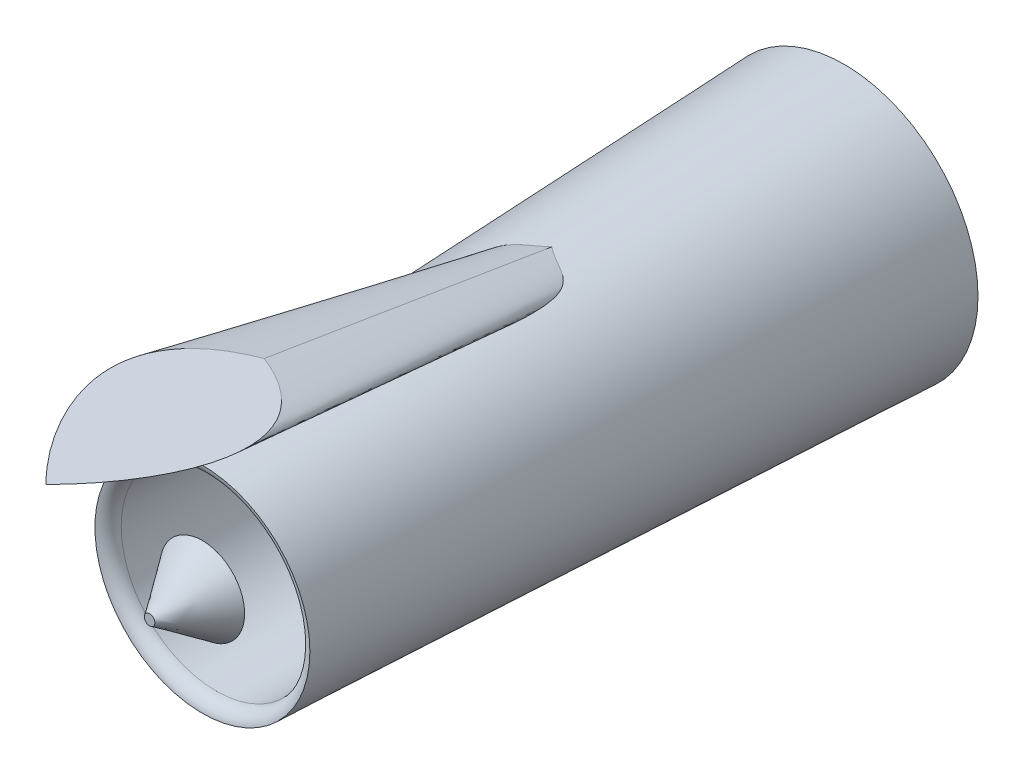
from build123d import *

# Parameters (mm, degrees)
SKETCH13_R              = 1159.51
SKETCH14_R              = 930.91
CUT_EXTRUDE1_DEPTH      = 10182.564733185
CUT_EXTRUDE1_DEPTH_BACK = 10182.564733185
SKETCH16_R              = 824.23
FILLET1_R               = 304.8
FILLET2_R               = 121.92


with BuildPart() as part:
    # Sketch13 → Loft2 section 0
    with BuildSketch(Plane.XY.offset(-1616.439178421)):
        with Locations((-7292.34, 0)):
            Circle(SKETCH13_R)
    # Sketch14 → Loft2 section 1
    with BuildSketch(Plane.XY.offset(3941.080821579)):
        with Locations((-7292.34, 0)):
            Circle(SKETCH14_R)
    loft()

    # Sketch16 → Cut-Extrude1 (cut, two sides: drawn at the far end of the back side and taken through both)
    with BuildSketch(Plane(origin=(0, 0, -1616.439178421), x_dir=(-1, 0, 0), z_dir=(0, 0, -1)).offset(-CUT_EXTRUDE1_DEPTH_BACK)):
        with Locations(Location((7292.34, 0, 0), (0, 0, 180))):
            Circle(SKETCH16_R)
    extrude(amount=CUT_EXTRUDE1_DEPTH + CUT_EXTRUDE1_DEPTH_BACK, mode=Mode.SUBTRACT)

    # Fillet1
    fillet1_edges = [part.edges().sort_by_distance(p)[0] for p in [
        (-8116.57, 0, -1616.439178421),
    ]]
    fillet(fillet1_edges, radius=FILLET1_R)

    # Fillet2
    # the kernel refuses this fillet: 121.92 mm, written as the material it takes off along each edge
    with BuildSketch(Plane(origin=(-7292.34, 0, 3941.080821579), x_dir=(1, 0, 0), z_dir=(0, 1, 0))) as fillet2_piece_1:
        with BuildLine():
            CenterArc((946.15, 120.963749942), FILLET2_R, 180, 82.819244219)
            Line((930.91, 0), (930.6052, -2.419274999))
            ThreePointArc((930.6052, -2.419274999), (877.57, -2.4384), (824.23, -2.4384))
            Line((824.23, -2.4384), (821.7916, 0))
            Line((821.7916, 0), (821.7916, 120.963749942))
            Line((821.7916, 120.963749942), (824.23, 120.963749942))
        make_face()
    revolve(axis=Axis((-7292.34, 0, 3941.080821579), (0, 0, -1)), mode=Mode.SUBTRACT)

    # Sketch20 → Loft4 section 0
    with BuildSketch(Plane(origin=(0, 1463.346394626, 0), x_dir=(1, 0, 0), z_dir=(0, 1, 0))):
        with BuildLine():
            add(Edge.make_bspline(
                [(-7292.34, -3406.150417238), (-6242.02499115, -3812.9932806), (-6806.427729263, -4813.335190791), (-7292.34, -5295.528257059)],
                knots=[0, 0, 0, 0, 1, 1, 1, 1], degree=3))
            add(Edge.make_bspline(
                [(-7292.34, -3406.150417238), (-8342.65500885, -3812.9932806), (-7778.252270737, -4813.335190791), (-7292.34, -5295.528257059)],
                knots=[0, 0, 0, 0, 1, 1, 1, 1], degree=3))
        make_face()
    # Sketch17 → Loft4 section 1
    with BuildSketch(Plane(origin=(0, 929.946394626, 0), x_dir=(1, 0, 0), z_dir=(0, 1, 0))):
        with BuildLine():
            add(Edge.make_bspline(
                [(-7292.34, -149.368821579), (-6646.095228766, -977.153508768), (-7181.494395174, -1981.271516216), (-7292.34, -2877.715495293)],
                knots=[0, 0, 0, 0, 1, 1, 1, 1], degree=3))
            add(Edge.make_bspline(
                [(-7292.34, -149.368821579), (-7938.584771234, -977.153508768), (-7403.185604826, -1981.271516216), (-7292.34, -2877.715495293)],
                knots=[0, 0, 0, 0, 1, 1, 1, 1], degree=3))
        make_face()
    loft()


with BuildPart() as body_2:
    # Loft3: read off the stored shape, not the designer's step
    # Loft3: loft between two sections, ruled curve by curve
    loft3_from = [
        Edge.make_bspline([(-7325.903473614, 31.045315894, 4398.280821579), (-7263.812841827, 98.172263122, 4398.280821579), (-7196.685894598, 36.081631335, 4398.280821579), (-7258.776526386, -31.045315894, 4398.280821579), (-7320.867158173, -98.172263122, 4398.280821579), (-7387.994105402, -36.081631335, 4398.280821579), (-7325.903473614, 31.045315894, 4398.280821579)], [0, 0, 0, 0, 0.5, 0.5, 0.5, 1, 1, 1, 1], 3, [1, 0.333333333, 0.333333333, 1, 0.333333333, 0.333333333, 1]),
    ]
    loft3_to = [
        Edge.make_bspline([(-7425.702229898, 340.580230249, 3941.080821579), (-6744.5417694, 607.304690046, 3941.080821579), (-6477.817309603, -73.855770452, 3941.080821579), (-7158.977770102, -340.580230249, 3941.080821579), (-7840.1382306, -607.304690046, 3941.080821579), (-8106.862690397, 73.855770452, 3941.080821579), (-7425.702229898, 340.580230249, 3941.080821579)], [0, 0, 0, 0, 0.5, 0.5, 0.5, 1, 1, 1, 1], 3, [1, 0.333333333, 0.333333333, 1, 0.333333333, 0.333333333, 1]),
    ]
    loft3 = Solid(Shell([*[Face.make_surface_from_curves(loft3_from[k], loft3_to[k]) for k in range(1)], Face(Wire(loft3_from)), Face(Wire(loft3_to))]))
    add(loft3)


solid = Compound([part.part, body_2.part])
